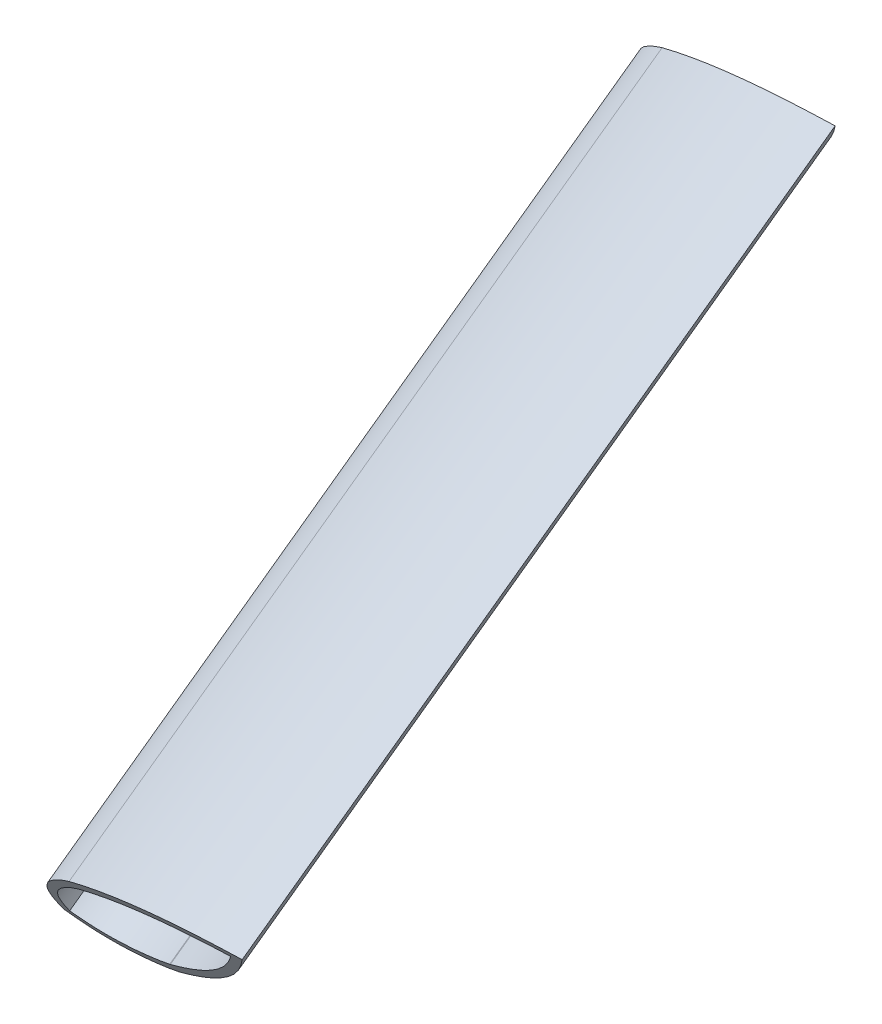
from build123d import *

# Parameters (mm, degrees)
BOSS_EXTRUDE1_DEPTH      = 91.359952
BOSS_EXTRUDE1_DEPTH_BACK = 91.359952
SKETCH1_R                = 6.35
SKETCH2_R                = 5.1943
CUT_EXTRUDE1_DEPTH       = 1020.644650611
EXTRUDE_THIN2_START      = -101.6
EXTRUDE_THIN2_DEPTH      = 101.6


# Read off the part's stored shape, not the designer's step: Extrude-Thin2
with BuildPart() as part:
    # Sketch1 → Boss-Extrude1 (new, two sides: drawn at the far end of the back side and taken through both)
    with BuildSketch(Plane(origin=(-797.858372093, 381.268468163, 361.489360836), x_dir=(0.9998902886126457, 0.009608155882865862, -0.011273600962007019), z_dir=(-0.014732692778449213, 0.5661762234602228, -0.8241525536888277)).offset(-BOSS_EXTRUDE1_DEPTH_BACK)):
        with Locations(Location((0, 0, 0), (0, 0, 90.088001086))):
            Circle(SKETCH1_R)
    extrude(amount=BOSS_EXTRUDE1_DEPTH + BOSS_EXTRUDE1_DEPTH_BACK)

    # Sketch2 → Cut-Extrude1 (cut, through all)
    with BuildSketch(Plane(origin=(-0.310230962, 11.922151452, -17.354440468), x_dir=(0.999890288612646, 0.009608155882749703, -0.011273600962086832), z_dir=(-0.014732692778449222, 0.5661762234602224, -0.8241525536888279))):
        with Locations(Location((-798.182837875, -520.172934132, 0), (0, 0, 270.088001086))):
            Circle(SKETCH2_R)
    extrude(amount=-CUT_EXTRUDE1_DEPTH, mode=Mode.SUBTRACT)


with BuildPart() as body_2:
    # Extrude-Thin2 outline → Extrude-Thin2 (new body)
    with BuildSketch(Plane(origin=(-0.310230962, 11.922151452, -17.354440468), x_dir=(-0.9998914679921496, -0.00834220575504257, 0.012143304313270938), z_dir=(-0.014732692778449226, 0.5661762234602217, -0.8241525536888284)).offset(EXTRUDE_THIN2_START)):
        with BuildLine():
            add(Edge.make_bspline(
                [(795.007403943, 512.444480964), (792.898832326, 513.716162183), (790.876982299, 515.117057901), (787.988681037, 517.417188527), (787.053117975, 518.21438231), (785.23640397, 519.869741584), (784.354204701, 520.729019996), (781.796982108, 523.3901752), (780.214112798, 525.272124548), (778.019643962, 528.241116236), (777.320291883, 529.252086912), (776.31726013, 530.799037937), (775.993088295, 531.321432242), (775.34485148, 532.366291694), (775.020733072, 532.88872142), (774.696614665, 533.411151146)],
                knots=[0, 0, 0, 0, 0.25, 0.25, 0.375, 0.375, 0.5, 0.5, 0.75, 0.75, 0.875, 0.875, 0.9375, 0.9375, 1, 1, 1, 1], degree=3))
            Line((795.007403943, 512.444480964), (795.192139039, 512.334444488))
            add(Edge.make_bspline(
                [(795.192139039, 512.334444488), (795.820659251, 512.014505469), (796.461986169, 511.727191335), (797.766110641, 511.207259179), (798.428497889, 510.973595907), (799.772806417, 510.556032006), (800.452591935, 510.372450513), (801.816227189, 510.07205513), (802.501964688, 509.954924004), (803.88371636, 509.807351912), (804.579705649, 509.776701036), (805.634083311, 509.818402312), (805.989339161, 509.847310141), (806.693578465, 509.938551358), (807.040945003, 510.000493885), (808.067844122, 510.238519077), (808.732238224, 510.466586402), (809.693938159, 510.928501806), (810.007225559, 511.10207874), (810.608415369, 511.482548524), (810.895772864, 511.693557881), (811.186337014, 511.899534791)],
                knots=[0, 0, 0, 0, 0.125, 0.125, 0.25, 0.25, 0.375, 0.375, 0.5, 0.5, 0.625, 0.625, 0.6875, 0.6875, 0.75, 0.75, 0.875, 0.875, 0.9375, 0.9375, 1, 1, 1, 1], degree=3))
            add(Edge.make_bspline(
                [(802.824178055, 525.525933285), (803.415067853, 525.141877964), (803.983569629, 524.729777367), (805.084606371, 523.860520869), (805.61754116, 523.403865824), (806.650104746, 522.448833612), (807.148417232, 521.952115017), (808.08922944, 520.921809356), (808.532960793, 520.386746599), (809.350508798, 519.264437037), (809.724494326, 518.677316278), (810.21478219, 517.743872092), (810.367122157, 517.421936823), (810.63971425, 516.766905357), (810.759520718, 516.435352914), (811.066210954, 515.427787282), (811.200580221, 514.738918347), (811.281121537, 513.675990605), (811.287384359, 513.318194206), (811.258437226, 512.607919011), (811.219408013, 512.253857446), (811.186337014, 511.899534791)],
                knots=[0, 0, 0, 0, 0.125, 0.125, 0.25, 0.25, 0.375, 0.375, 0.5, 0.5, 0.625, 0.625, 0.6875, 0.6875, 0.75, 0.75, 0.875, 0.875, 0.9375, 0.9375, 1, 1, 1, 1], degree=3))
            add(Edge.make_bspline(
                [(802.824178055, 525.525933285), (800.700286301, 526.77528344), (798.504727379, 527.888310329), (795.104625441, 529.334637361), (793.957375, 529.778259938), (791.635103666, 530.588520593), (790.458590691, 530.95555421), (786.898386756, 531.938184836), (784.488036247, 532.434463461), (780.829672903, 532.950837392), (779.606779988, 533.084498644), (777.76751946, 533.229941481), (777.153344334, 533.266248665), (775.9249795, 533.338699906), (775.310797082, 533.374925526), (774.696614665, 533.411151146)],
                knots=[0, 0, 0, 0, 0.25, 0.25, 0.375, 0.375, 0.5, 0.5, 0.75, 0.75, 0.875, 0.875, 0.9375, 0.9375, 1, 1, 1, 1], degree=3))
        make_face()
        with BuildLine():
            Line((795.805834227, 513.447123796), (795.657315978, 513.5355879))
            add(Edge.make_bspline(
                [(795.657315978, 513.5355879), (784.256115309, 520.41167093), (777.067204021, 531.999122223)],
                knots=[0, 0, 0, 1, 1, 1], degree=2))
            add(Edge.make_bspline(
                [(802.155834227, 524.445646424), (790.679875453, 531.196221565), (777.067204021, 531.999122223)],
                knots=[0, 0, 0, 1, 1, 1], degree=2))
            add(Edge.make_bspline(
                [(802.155834227, 524.445646424), (803.357131939, 523.664849768), (807.630718362, 520.192997769), (810.29114838, 515.974403166), (809.976037151, 512.598301742)],
                knots=[0, 0, 0, 0, 0.294150136, 1, 1, 1, 1], degree=3))
            add(Edge.make_bspline(
                [(795.805834227, 513.447123796), (797.082672823, 512.797167788), (802.226178064, 510.832059381), (807.209803167, 510.637356701), (809.976037151, 512.598301742)],
                knots=[0, 0, 0, 0, 0.294150136, 1, 1, 1, 1], degree=3))
        make_face(mode=Mode.SUBTRACT)
    extrude(amount=EXTRUDE_THIN2_DEPTH)


solid = body_2.part
